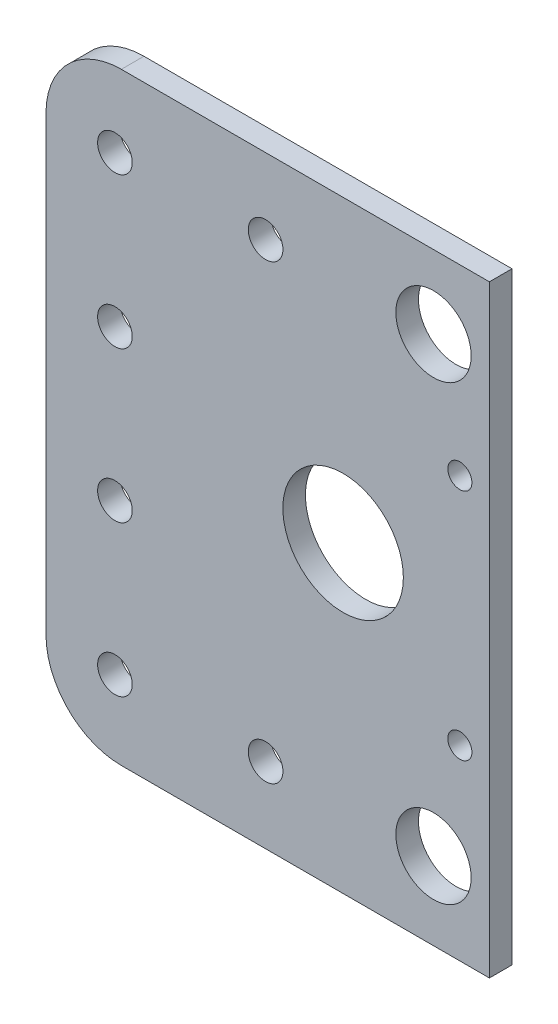
from build123d import *

# Parameters (mm, degrees)
SKETCH1_R           = 2.3
SKETCH1_R_2         = 1.6
SKETCH1_R_3         = 8
SKETCH1_R_4         = 5
BOSS_EXTRUDE1_DEPTH = 3


with BuildPart() as part:
    # Sketch1 → Boss-Extrude1 (new body)
    with BuildSketch(Plane.XY):
        with BuildLine():
            Line((157.960700719, -71.866196008), (165.380720324, -71.866196008))
            Line((165.380720324, -71.866196008), (165.380720324, -151.896756479))
            Line((165.380720324, -151.896756479), (157.960700719, -151.896756479))
            Line((157.960700719, -151.896756479), (116.525823666, -151.896756479))
            ThreePointArc((116.525823666, -151.896756479), (109.454755854, -148.967824291), (106.525823666, -141.896756479))
            Line((106.525823666, -141.896756479), (106.525823666, -81.866196008))
            ThreePointArc((106.525823666, -81.866196008), (109.454755854, -74.795128196), (116.525823666, -71.866196008))
            Line((116.525823666, -71.866196008), (157.960700719, -71.866196008))
        make_face()
        with Locations((115.674612816, -101.866196008)):
            Circle(SKETCH1_R, mode=Mode.SUBTRACT)
        with Locations((115.674612816, -121.866196008)):
            Circle(SKETCH1_R, mode=Mode.SUBTRACT)
        with Locations((135.674612816, -141.866196008)):
            Circle(SKETCH1_R, mode=Mode.SUBTRACT)
        with Locations((135.674612816, -81.866196008)):
            Circle(SKETCH1_R, mode=Mode.SUBTRACT)
        with Locations((115.674612816, -81.866196008)):
            Circle(SKETCH1_R, mode=Mode.SUBTRACT)
        with Locations((115.674612816, -141.866196008)):
            Circle(SKETCH1_R, mode=Mode.SUBTRACT)
        with Locations((161.460700719, -96.114221831)):
            Circle(SKETCH1_R_2, mode=Mode.SUBTRACT)
        with Locations((161.460700719, -127.114221831)):
            Circle(SKETCH1_R_2, mode=Mode.SUBTRACT)
        with Locations((145.960700719, -111.591712302)):
            Circle(SKETCH1_R_3, mode=Mode.SUBTRACT)
        with Locations((157.960700719, -81.591712302)):
            Circle(SKETCH1_R_4, mode=Mode.SUBTRACT)
        with Locations((157.960700719, -141.591712302)):
            Circle(SKETCH1_R_4, mode=Mode.SUBTRACT)
    extrude(amount=BOSS_EXTRUDE1_DEPTH)


solid = part.part
